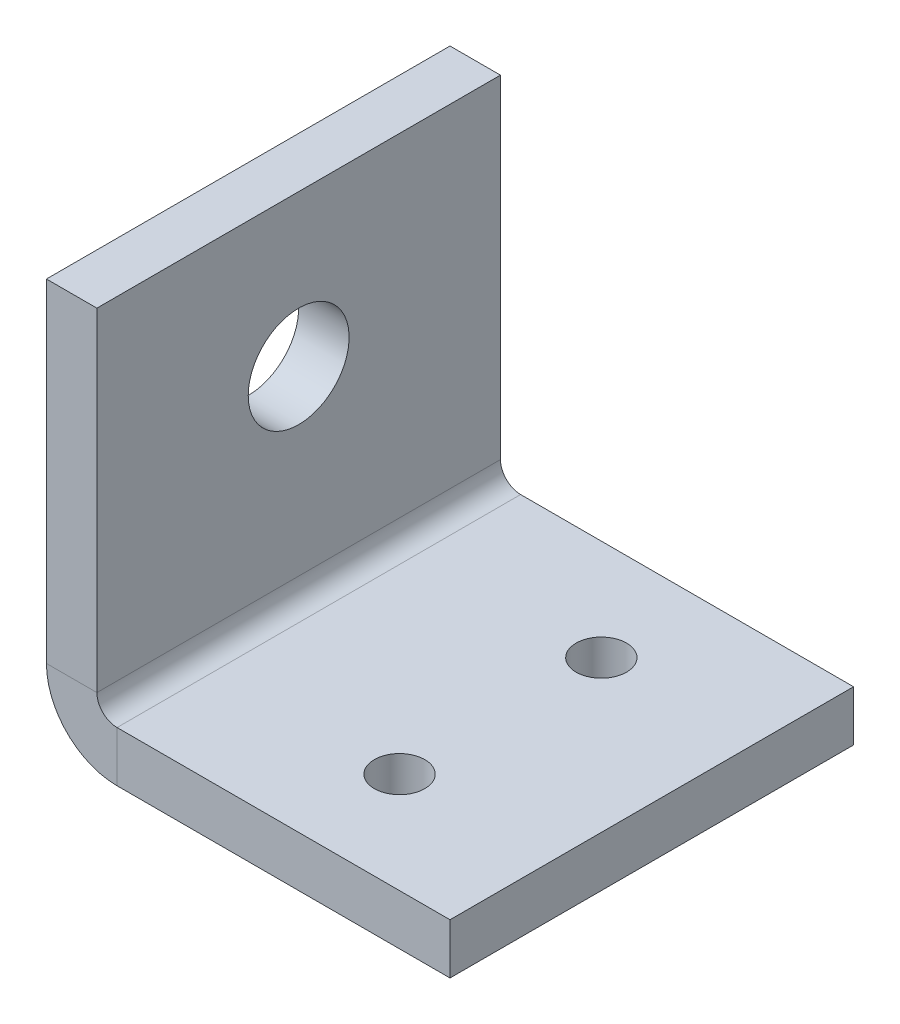
from build123d import *

# Parameters (mm, degrees)
BASE_FLANGE1_DEPTH = 20
SKETCH6_R          = 5
CUT_EXTRUDE1_DEPTH = 10
SKETCH7_R          = 2.5
CUT_EXTRUDE2_DEPTH = 5


# Sheet-metal steps are written as plain solids
with BuildPart() as part:
    # Sketch1 → Base-Flange1 (new, symmetric)
    with BuildSketch(Plane.XY):
        with BuildLine():
            Line((0, 0), (-33, 0))
            ThreePointArc((-33, 0), (-37.949747468, 2.050252532), (-40, 7))
            Line((-40, 7), (-40, 40))
            Line((-40, 40), (-35, 40))
            Line((-35, 40), (-35, 7))
            ThreePointArc((-35, 7), (-34.414213562, 5.585786438), (-33, 5))
            Line((-33, 5), (0, 5))
            Line((0, 5), (0, 0))
        make_face()
    extrude(amount=BASE_FLANGE1_DEPTH, both=True)

    # Sketch6 → Cut-Extrude1 (cut)
    with BuildSketch(Plane.ZY.offset(40)):
        with Locations((0, 25)):
            Circle(SKETCH6_R)
    extrude(amount=-CUT_EXTRUDE1_DEPTH, mode=Mode.SUBTRACT)

    # Sketch7 → Cut-Extrude2 (cut)
    with BuildSketch(Plane(origin=(0, 5, 0), x_dir=(1, 0, 0), z_dir=(0, 1, 0))):
        with Locations(Location((-15, 10, 0), (0, 0, 270))):
            Circle(SKETCH7_R)
        with Locations(Location((-15, -10, 0), (0, 0, 270))):
            Circle(SKETCH7_R)
    extrude(amount=-CUT_EXTRUDE2_DEPTH, mode=Mode.SUBTRACT)


solid = part.part
